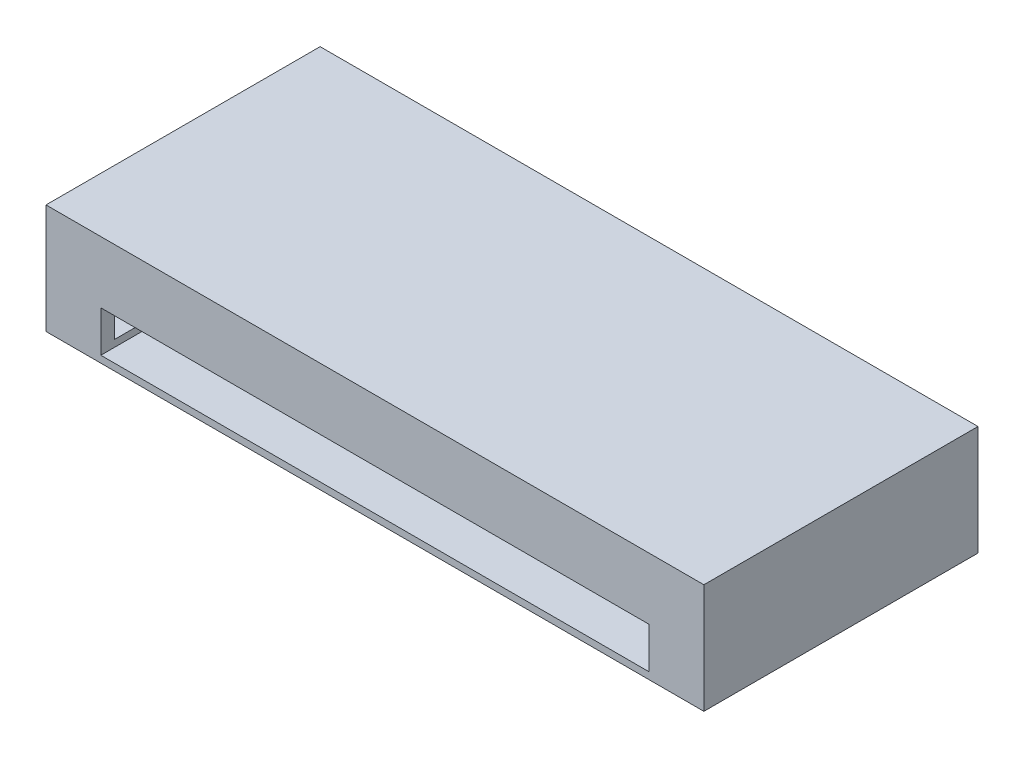
from build123d import *

# Parameters (mm, degrees)
SKETCH1_W               = 304.8
SKETCH1_H               = 127
BOSS_EXTRUDE1_DEPTH     = 50.8
SHELL1_T                = 6.35
CUT_EXTRUDE1_DEPTH      = 205.781346807
CUT_EXTRUDE1_DEPTH_BACK = 205.781346807
SKETCH2_W               = 254
SKETCH2_H               = 19.05


with BuildPart() as part:
    # Sketch1 → Boss-Extrude1 (new body)
    with BuildSketch(Plane(origin=(0, 0, 0), x_dir=(1, 0, 0), z_dir=(0, 1, 0))):
        Rectangle(SKETCH1_W, SKETCH1_H)
    extrude(amount=BOSS_EXTRUDE1_DEPTH)

    # Shell1 (no face opened: a closed hollow body)
    add(offset(amount=-SHELL1_T, mode=Mode.PRIVATE), mode=Mode.SUBTRACT)

    # Sketch2 → Cut-Extrude1 (cut, two sides: drawn at the far end of the back side and taken through both)
    with BuildSketch(Plane.XY.offset(63.5).offset(-CUT_EXTRUDE1_DEPTH_BACK)):
        with Locations((0, 12.7)):
            Rectangle(SKETCH2_W, SKETCH2_H)
    extrude(amount=CUT_EXTRUDE1_DEPTH + CUT_EXTRUDE1_DEPTH_BACK, mode=Mode.SUBTRACT)


solid = part.part
